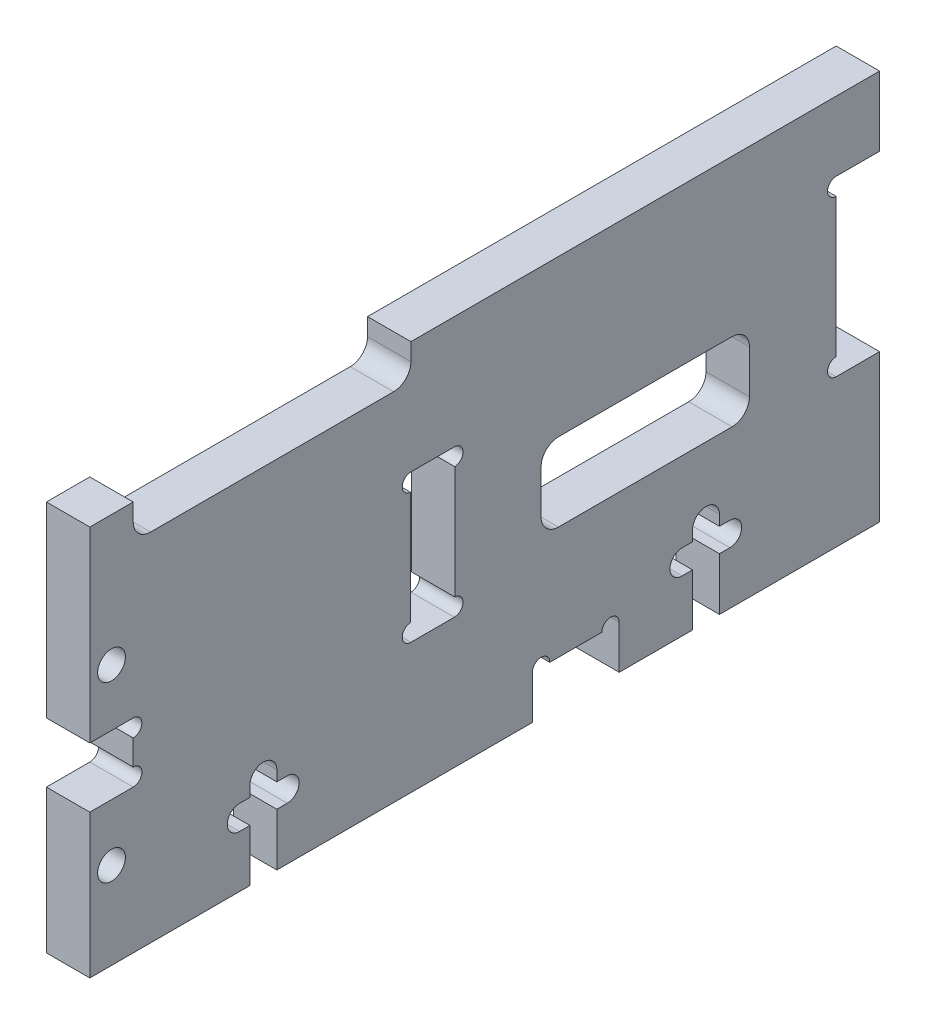
from build123d import *

# Parameters (mm, degrees)
SKETCH_1_W           = 91
SKETCH_1_H           = 45
EXTRUDE_1_DEPTH      = 5
SKETCH_7_W           = 24
SKETCH_7_H           = 9
CUT_EXTRUDE_3_DEPTH  = 10
FILLET_1_R           = 2
SKETCH_8_W           = 32
SKETCH_8_H           = 4
CUT_EXTRUDE_4_DEPTH  = 10
FILLET_2_R           = 2
SKETCH_9_W           = 5
SKETCH_9_H           = 17
CUT_EXTRUDE_5_DEPTH  = 5
SKETCH_14_R          = 1.55
CUT_EXTRUDE_9_DEPTH  = 10
SKETCH_10_R          = 1
CUT_EXTRUDE_6_DEPTH  = 10
SKETCH_12_R          = 1.6
CUT_EXTRUDE_7_DEPTH  = 10
CUT_EXTRUDE_8_DEPTH  = 10
SKETCH_15_W          = 10
SKETCH_15_H          = 5
CUT_EXTRUDE_10_DEPTH = 10
SKETCH_19_W          = 5
SKETCH_19_H          = 6.9
SKETCH_19_H_2        = 20
CUT_EXTRUDE_14_DEPTH = 5
SKETCH_16_R          = 1
CUT_EXTRUDE_11_DEPTH = 10
SKETCH_20_W          = 5.1
SKETCH_20_H          = 15.197667804
CUT_EXTRUDE_15_DEPTH = 10


with BuildPart() as part:
    # 스케치1 → 보스-돌출1 (new body)
    with BuildSketch(Plane(origin=(0, 0, 0), x_dir=(0, 0, -1), z_dir=(1, 0, 0))):
        with Locations((45.5, 22.5)):
            Rectangle(SKETCH_1_W, SKETCH_1_H)
    extrude(amount=EXTRUDE_1_DEPTH)

    # 스케치7 → 컷-돌출3 (cut)
    with BuildSketch(Plane(origin=(5, 0, 0), x_dir=(0, 0, -1), z_dir=(1, 0, 0))):
        with Locations((64, 22.5)):
            Rectangle(SKETCH_7_W, SKETCH_7_H)
    extrude(amount=-CUT_EXTRUDE_3_DEPTH, mode=Mode.SUBTRACT)

    # 필렛1
    fillet_1_edges = [part.edges().sort_by_distance(p)[0] for p in [
        (2.5, 18, -52),
        (2.5, 18, -76),
        (2.5, 27, -76),
        (2.5, 27, -52),
    ]]
    fillet(fillet_1_edges, radius=FILLET_1_R)

    # 스케치8 → 컷-돌출4 (cut)
    with BuildSketch(Plane(origin=(5, 0, 0), x_dir=(0, 0, -1), z_dir=(1, 0, 0))):
        with Locations((21, 43)):
            Rectangle(SKETCH_8_W, SKETCH_8_H)
    extrude(amount=-CUT_EXTRUDE_4_DEPTH, mode=Mode.SUBTRACT)

    # 필렛2
    fillet_2_edges = [part.edges().sort_by_distance(p)[0] for p in [
        (2.5, 41, -37),
        (2.5, 41, -5),
    ]]
    fillet(fillet_2_edges, radius=FILLET_2_R)

    # 스케치9 → 컷-돌출5 (cut)
    with BuildSketch(Plane.ZY):
        with Locations((-39.5, 23.5)):
            Rectangle(SKETCH_9_W, SKETCH_9_H)
    extrude(amount=-CUT_EXTRUDE_5_DEPTH, mode=Mode.SUBTRACT)

    # 스케치14 → 컷-돌출9 (cut)
    with BuildSketch(Plane(origin=(5, 0, 0), x_dir=(0, 0, -1), z_dir=(1, 0, 0))):
        with Locations((2.5, 10)):
            Circle(SKETCH_14_R)
        with Locations((2.5, 30)):
            Circle(SKETCH_14_R)
    extrude(amount=-CUT_EXTRUDE_9_DEPTH, mode=Mode.SUBTRACT)

    # 스케치10 → 컷-돌출6 (cut)
    with BuildSketch(Plane(origin=(5, 0, 0), x_dir=(0, 0, -1), z_dir=(1, 0, 0))):
        with Locations((42, 31)):
            Circle(SKETCH_10_R)
        with Locations((42, 16)):
            Circle(SKETCH_10_R)
        with Locations((37, 16)):
            Circle(SKETCH_10_R)
        with Locations((37, 31)):
            Circle(SKETCH_10_R)
    extrude(amount=-CUT_EXTRUDE_6_DEPTH, mode=Mode.SUBTRACT)

    # 스케치12 → 컷-돌출7 (cut)
    with BuildSketch(Plane(origin=(5, 0, 0), x_dir=(0, 0, -1), z_dir=(1, 0, 0))):
        with Locations((2.5, 30)):
            Circle(SKETCH_12_R)
        with Locations((2.5, 10)):
            Circle(SKETCH_12_R)
    extrude(amount=-CUT_EXTRUDE_7_DEPTH, mode=Mode.SUBTRACT)

    # 스케치13 → 컷-돌출8 (cut)
    with BuildSketch(Plane(origin=(5, 0, 0), x_dir=(0, 0, -1), z_dir=(1, 0, 0))):
        with BuildLine():
            Line((18.45, 0), (18.45, 6))
            Line((18.45, 6), (17.250192706, 6))
            ThreePointArc((17.250192706, 6), (15.841386702, 7.391138254), (17.232524956, 8.799944258))
            Line((17.232524956, 8.799944258), (18.45, 8.799944258))
            Line((18.45, 8.799944258), (18.45, 10))
            ThreePointArc((18.45, 10), (20, 11.55), (21.55, 10))
            Line((21.55, 10), (21.55, 8.799872773))
            Line((21.55, 8.799872773), (22.749807294, 8.799872773))
            ThreePointArc((22.749807294, 8.799872773), (24.117188413, 7.432491654), (22.749807294, 6.065110535))
            Line((22.749807294, 6.065110535), (21.55, 6.065110535))
            Line((21.55, 6.065110535), (21.55, 0))
            Line((21.55, 0), (18.45, 0))
        make_face()
        with BuildLine():
            Line((72.55, 0), (72.55, 6.065110535))
            Line((72.55, 6.065110535), (73.749807294, 6.065110535))
            ThreePointArc((73.749807294, 6.065110535), (75.117188413, 7.432491654), (73.749807294, 8.799872773))
            Line((73.749807294, 8.799872773), (72.55, 8.799872773))
            Line((72.55, 8.799872773), (72.55, 10))
            ThreePointArc((72.55, 10), (71, 11.55), (69.45, 10))
            Line((69.45, 10), (69.45, 8.799944258))
            Line((69.45, 8.799944258), (68.232524956, 8.799944258))
            ThreePointArc((68.232524956, 8.799944258), (66.841386702, 7.391138254), (68.250192706, 6))
            Line((68.250192706, 6), (69.45, 6))
            Line((69.45, 6), (69.45, 0))
            Line((69.45, 0), (72.55, 0))
        make_face()
    extrude(amount=-CUT_EXTRUDE_8_DEPTH, mode=Mode.SUBTRACT)

    # 스케치15 → 컷-돌출10 (cut)
    with BuildSketch(Plane(origin=(5, 0, 0), x_dir=(0, 0, -1), z_dir=(1, 0, 0))):
        with Locations((56, 2.5)):
            Rectangle(SKETCH_15_W, SKETCH_15_H)
    extrude(amount=-CUT_EXTRUDE_10_DEPTH, mode=Mode.SUBTRACT)

    # 스케치19 → 컷-돌출14 (cut)
    with BuildSketch(Plane.ZY):
        with Locations((-2.5, 20)):
            Rectangle(SKETCH_19_W, SKETCH_19_H)
        with Locations((-88.5, 27)):
            Rectangle(SKETCH_19_W, SKETCH_19_H_2)
    extrude(amount=-CUT_EXTRUDE_14_DEPTH, mode=Mode.SUBTRACT)

    # 스케치16 → 컷-돌출11 (cut)
    with BuildSketch(Plane.ZY):
        with Locations((-60, 5)):
            Circle(SKETCH_16_R)
        with Locations((-52, 5)):
            Circle(SKETCH_16_R)
        with Locations((-86, 36)):
            Circle(SKETCH_16_R)
        with Locations((-86, 18)):
            Circle(SKETCH_16_R)
        with Locations((-5, 22.45)):
            Circle(SKETCH_16_R)
        with Locations((-5, 17.55)):
            Circle(SKETCH_16_R)
    extrude(amount=-CUT_EXTRUDE_11_DEPTH, mode=Mode.SUBTRACT)

    # 스케치20 → 컷-돌출15 (cut)
    with BuildSketch(Plane(origin=(5, 0, 0), x_dir=(0, 0, -1), z_dir=(1, 0, 0))):
        with Locations((39.5, 23.598833902)):
            Rectangle(SKETCH_20_W, SKETCH_20_H)
    extrude(amount=-CUT_EXTRUDE_15_DEPTH, mode=Mode.SUBTRACT)


solid = part.part
